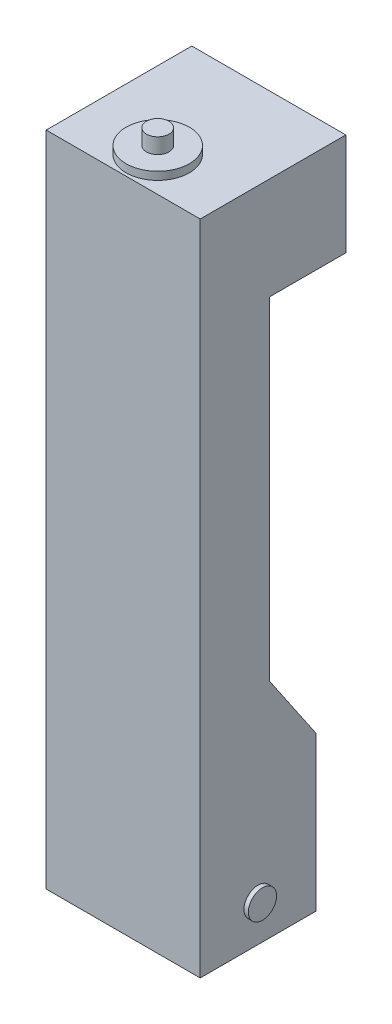
from build123d import *
from OCP.BRepFilletAPI import BRepFilletAPI_MakeChamfer

# Parameters (mm, degrees)
SKETCH1_W            = 41
SKETCH1_H            = 40.2
BOSS_EXTRUDE1_DEPTH  = 61.1
SKETCH2_R            = 14
BOSS_EXTRUDE2_DEPTH  = 3
SKETCH3_R            = 4.9
BOSS_EXTRUDE3_DEPTH  = 4.8
CHAMFER1_SIZE        = 7.5
CHAMFER1_SIZE2       = 5.1
MIRROR5_START        = -20.5
MIRROR5_DEPTH        = 41
BOSS_EXTRUDE4_DEPTH  = 1.5
BOSS_EXTRUDE5_DEPTH  = 4.7625
SKETCH7_W            = 35.6
SKETCH7_H            = 50.6
BOSS_EXTRUDE6_DEPTH  = 35.5
SKETCH9_W            = 29.5
SKETCH9_H            = 35
BOSS_EXTRUDE7_DEPTH  = 39.8
SKETCH10_R           = 11
BOSS_EXTRUDE8_DEPTH  = 2.75
SKETCH11_R           = 3.9
BOSS_EXTRUDE9_DEPTH  = 5.35
SKETCH12_W           = 50.6
SKETCH12_H           = 35.5
BOSS_EXTRUDE10_DEPTH = 8.9625
SKETCH13_W           = 50.6
SKETCH13_H           = 35.5
BOSS_EXTRUDE11_DEPTH = 8.9625
SKETCH14_W           = 53.520973266
SKETCH14_H           = 24
BOSS_EXTRUDE12_DEPTH = 131.85
SKETCH15_W           = 53.525
SKETCH15_H           = 28.80973019
BOSS_EXTRUDE13_DEPTH = 10
SKETCH16_W           = 44
SKETCH16_H           = 7.5
BOSS_EXTRUDE14_DEPTH = 10
SKETCH17_W           = 53.525
SKETCH17_H           = 40.184191337
BOSS_EXTRUDE15_DEPTH = 44


# Read off the part's stored shape, not the designer's step: Mirror5
with BuildPart() as part:
    # Sketch1 → Boss-Extrude1 (new body)
    with BuildSketch(Plane(origin=(0, -13, 0), x_dir=(-1, 0, 0), z_dir=(0, 1, 0))):
        Rectangle(SKETCH1_W, SKETCH1_H)
    extrude(amount=BOSS_EXTRUDE1_DEPTH)

    # Sketch2 → Boss-Extrude2 (add)
    with BuildSketch(Plane.ZY.offset(20.5)):
        with Locations(Location((0, 0, 0), (0, 0, 248.213210702))):
            Circle(SKETCH2_R)
    boss_extrude2 = extrude(amount=BOSS_EXTRUDE2_DEPTH)

    # Sketch3 → Boss-Extrude3 (add)
    with BuildSketch(Plane.ZY.offset(23.5)):
        Circle(SKETCH3_R)
    boss_extrude3 = extrude(amount=BOSS_EXTRUDE3_DEPTH)

    # Chamfer1: one chamfer whose edges measure the first distance from different faces: ONE call of the kernel's chamfer builder (chamfer() names one face for all edges)
    chamfer1_edges_1 = [part.edges().sort_by_distance(p)[0] for p in [
        (0, 48.1, -20.1),
    ]]
    chamfer1_side_1 = [part.faces().sort_by_distance(p)[0] for p in [
        (0, 17.55, -20.1),
    ]]
    chamfer1_edges_2 = [part.edges().sort_by_distance(p)[0] for p in [
        (0, 48.1, 20.1),
    ]]
    chamfer1_side_2 = [part.faces().sort_by_distance(p)[0] for p in [
        (0, 17.55, 20.1),
    ]]
    chamfer1 = BRepFilletAPI_MakeChamfer(part.part.solid().wrapped)
    for e in chamfer1_edges_1:
        chamfer1.Add(CHAMFER1_SIZE, CHAMFER1_SIZE2, e.wrapped, chamfer1_side_1[0].wrapped)  # the first distance lies on this face
    for e in chamfer1_edges_2:
        chamfer1.Add(CHAMFER1_SIZE, CHAMFER1_SIZE2, e.wrapped, chamfer1_side_2[0].wrapped)  # the first distance lies on this face
    add(Compound.cast(chamfer1.Shape()), mode=Mode.REPLACE)

    # Mirror5 outline → Mirror5 (cut)
    with BuildSketch(Plane.YZ.offset(MIRROR5_START)):
        Polygon((-13, 20.1), (-13, 15), (-5.5, 20.1), align=None)
        Polygon((-5.5, -20.1), (-13, -15), (-13, -20.1), align=None)
    extrude(amount=MIRROR5_DEPTH, mode=Mode.SUBTRACT)

    # Sketch4 → Boss-Extrude4 (add)
    with BuildSketch(Plane.ZY.offset(20.5)):
        Polygon((-20.1, 15.2), (20.1, 15.2), (20.1, 40.6), (15, 48.1), (-15, 48.1), (-20.1, 40.6), align=None)
    boss_extrude4 = extrude(amount=BOSS_EXTRUDE4_DEPTH)

    # Mirror1: Boss-Extrude2, Boss-Extrude3, Boss-Extrude4 across plane
    add(boss_extrude2.mirror(Plane(origin=(0, 0, 0), x_dir=(0, 0, 1), z_dir=(1, 0, 0))))
    add(boss_extrude3.mirror(Plane(origin=(0, 0, 0), x_dir=(0, 0, 1), z_dir=(1, 0, 0))))
    add(boss_extrude4.mirror(Plane(origin=(0, 0, 0), x_dir=(0, 0, 1), z_dir=(1, 0, 0))))

    # Sketch6 → Boss-Extrude5 (add)
    with BuildSketch(Plane(origin=(22, 0, 0), x_dir=(0, 0, -1), z_dir=(1, 0, 0))):
        Polygon((20.1, 15.2), (20.1, 40.6), (3.9, 64.423529412), (3.9, 215.2), (-20.1, 215.2), (-20.1, 25.2), (4.9, 15.2), align=None)
    boss_extrude5 = extrude(amount=BOSS_EXTRUDE5_DEPTH)

    # Mirror2: Boss-Extrude5 across plane
    add(boss_extrude5.mirror(Plane(origin=(0, 0, 0), x_dir=(0, 0, 1), z_dir=(1, 0, 0))))



with BuildPart() as body_2:
    # Sketch7 → Boss-Extrude6 (new body)
    with BuildSketch(Plane(origin=(0, 215.45, 0), x_dir=(-1, 0, 0), z_dir=(0, 1, 0))):
        with Locations((0, -5.2)):
            Rectangle(SKETCH7_W, SKETCH7_H)
    extrude(amount=-BOSS_EXTRUDE6_DEPTH)


with BuildPart() as part_1:
    add(part.part)

    add(body_2.part)  # Boss-Extrude7 merges body 2
    # Sketch9 → Boss-Extrude7 (add)
    with BuildSketch(Plane.ZY.offset(-22)):
        with Locations((5.35, 197.7)):
            Rectangle(SKETCH9_W, SKETCH9_H)
    boss_extrude7 = extrude(amount=BOSS_EXTRUDE7_DEPTH)

    # Mirror3: Boss-Extrude7 across plane
    add(boss_extrude7.mirror(Plane(origin=(0, 0, 0), x_dir=(0, 0, 1), z_dir=(1, 0, 0))))

    # Sketch10 → Boss-Extrude8 (add)
    with BuildSketch(Plane(origin=(0, 215.45, 0), x_dir=(-1, 0, 0), z_dir=(0, 1, 0))):
        with Locations(Location((0, 8.1, 0), (0, 0, 270))):
            Circle(SKETCH10_R)
    extrude(amount=BOSS_EXTRUDE8_DEPTH)

    # Sketch11 → Boss-Extrude9 (add)
    with BuildSketch(Plane(origin=(0, 218.2, 0), x_dir=(-1, 0, 0), z_dir=(0, 1, 0))):
        with Locations(Location((0, 8.1, 0), (0, 0, 90))):
            Circle(SKETCH11_R)
    extrude(amount=BOSS_EXTRUDE9_DEPTH)

    # Sketch12 → Boss-Extrude10 (add)
    with BuildSketch(Plane(origin=(17.8, 0, 0), x_dir=(0, 0, -1), z_dir=(1, 0, 0))):
        with Locations((5.2, 197.7)):
            Rectangle(SKETCH12_W, SKETCH12_H)
    extrude(amount=BOSS_EXTRUDE10_DEPTH)

    # Sketch13 → Boss-Extrude11 (add)
    with BuildSketch(Plane.ZY.offset(17.8)):
        with Locations((-5.2, 197.7)):
            Rectangle(SKETCH13_W, SKETCH13_H)
    extrude(amount=BOSS_EXTRUDE11_DEPTH)

    # Sketch14 → Boss-Extrude12 (add)
    with BuildSketch(Plane.XZ.offset(-179.95)):
        with Locations((-0.002013367, 8.1)):
            Rectangle(SKETCH14_W, SKETCH14_H)
    extrude(amount=BOSS_EXTRUDE12_DEPTH)

    # Sketch15 → Boss-Extrude13 (add)
    with BuildSketch(Plane(origin=(0, 22.183698031, -32.623085339), x_dir=(-1, 0, 0), z_dir=(0, 0.562310021407278, -0.826926502069529))):
        with Locations((0, 36.675649649)):
            Rectangle(SKETCH15_W, SKETCH15_H)
    extrude(amount=-BOSS_EXTRUDE13_DEPTH)

    # Sketch16 → Boss-Extrude14 (add)
    with BuildSketch(Plane.XY.offset(20.1)):
        with Locations((0, 44.35)):
            Rectangle(SKETCH16_W, SKETCH16_H)
    extrude(amount=-BOSS_EXTRUDE14_DEPTH)

    # Sketch17 → Boss-Extrude15 (add)
    with BuildSketch(Plane.XZ.offset(13)):
        with Locations((0, 0.007904332)):
            Rectangle(SKETCH17_W, SKETCH17_H)
    extrude(amount=-BOSS_EXTRUDE15_DEPTH)


solid = part_1.part
